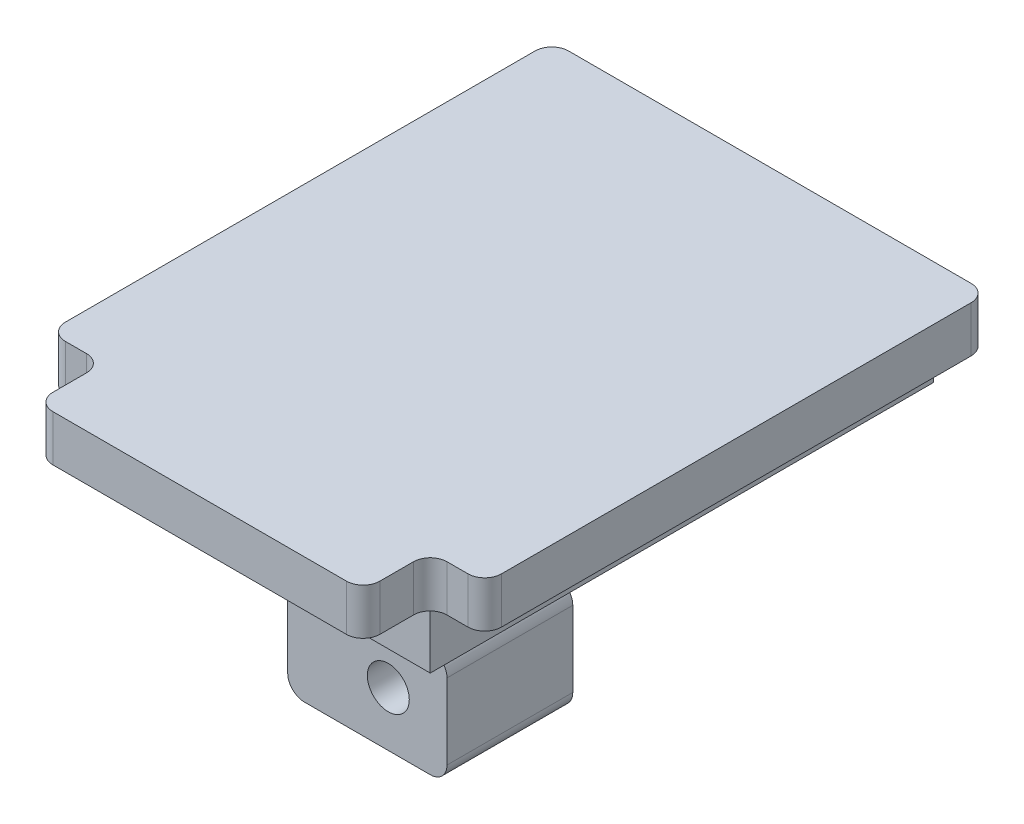
from build123d import *

# Parameters (mm, degrees)
BOSS_EXTRUDE1_DEPTH = 60
SKETCH2_W           = 39
SKETCH2_H           = 5.5
BOSS_EXTRUDE2_DEPTH = 8
FILLET2_R           = 2
SKETCH3_W           = 6
SKETCH3_H           = 15
BOSS_EXTRUDE3_DEPTH = 12
SKETCH4_W           = 19
SKETCH4_H           = 15
BOSS_EXTRUDE4_DEPTH = 13
FILLET3_R           = 2
SKETCH5_R           = 2.5
CUT_EXTRUDE1_DEPTH  = 65.439894475


# Some blends are built 0.0001 mm under size
with BuildPart() as part:
    # Sketch1 → Boss-Extrude1 (new body)
    with BuildSketch(Plane.XY):
        Polygon((-26, 0), (26, 0), (26, -5.5), (19.5, -5.5), (19.5, -12.5), (-19.5, -12.5), (-19.5, -5.5), (-26, -5.5), align=None)
    extrude(amount=BOSS_EXTRUDE1_DEPTH)

    # Sketch2 → Boss-Extrude2 (add)
    with BuildSketch(Plane.XY.offset(60)):
        with Locations((0, -2.75)):
            Rectangle(SKETCH2_W, SKETCH2_H)
    extrude(amount=BOSS_EXTRUDE2_DEPTH)

    # Fillet2
    # the kernel refuses this fillet: 2 mm, written as the material it adds along each edge
    with BuildSketch(Plane(origin=(-19.5, 0, 60), x_dir=(-1, 0, 0), z_dir=(0, -1, 0)), Plane(origin=(19.5, -5.5, 60), x_dir=(1, 0, 0), z_dir=(0, 1, 0))) as fillet2_piece_1:
        with BuildLine():
            CenterArc((FILLET2_R, -FILLET2_R), FILLET2_R, 90, 90)
            Line((0, -FILLET2_R), (0, 0))
            Line((0, 0), (FILLET2_R, 0))
        make_face()
    extrude(amount=5.5)
    # the kernel refuses this fillet: 2 mm, written as the material it takes off along each edge
    with BuildSketch(Plane(origin=(26, 5, 60), x_dir=(-1, 0, 0), z_dir=(0, -1, 0)), Plane(origin=(-19.5, 5, 68), x_dir=(0, 0, -1), z_dir=(0, -1, 0)), Plane(origin=(-26, -10.5, 0), x_dir=(0, 0, 1), z_dir=(0, 1, 0)), Plane(origin=(26, 5, 0), x_dir=(0, 0, 1), z_dir=(0, -1, 0))) as fillet2_2_piece_1:
        with BuildLine():
            CenterArc((FILLET2_R, FILLET2_R), FILLET2_R, 180, 90)
            Line((0, FILLET2_R), (0, 0))
            Line((0, 0), (FILLET2_R, 0))
        make_face()
    extrude(amount=15.5, mode=Mode.SUBTRACT)
    with BuildSketch(Plane(origin=(-26, -10.5, 60), x_dir=(0, 0, -1), z_dir=(0, 1, 0)), Plane(origin=(19.5, -10.5, 68), x_dir=(-1, 0, 0), z_dir=(0, 1, 0))) as fillet2_2_piece_2:
        with BuildLine():
            CenterArc((FILLET2_R, -FILLET2_R), FILLET2_R, 90, 90)
            Line((0, -FILLET2_R), (0, 0))
            Line((0, 0), (FILLET2_R, 0))
        make_face()
    extrude(amount=15.5, mode=Mode.SUBTRACT)

    # Sketch3 → Boss-Extrude3 (add)
    with BuildSketch(Plane.XZ.offset(12.5)):
        with Locations((0, 38)):
            Rectangle(SKETCH3_W, SKETCH3_H)
    extrude(amount=BOSS_EXTRUDE3_DEPTH)

    # Sketch4 → Boss-Extrude4 (add)
    with BuildSketch(Plane.XZ.offset(24.5)):
        with Locations((-2.5, 38)):
            Rectangle(SKETCH4_W, SKETCH4_H)
    extrude(amount=BOSS_EXTRUDE4_DEPTH)

    # Fillet3
    fillet3_edges = [part.edges().sort_by_distance(p)[0] for p in [
        (7, -24.5, 38),
        (-12, -24.5, 38),
        (7, -37.5, 38),
        (-12, -37.5, 38),
        (3, -24.5, 38),
        (-3, -24.5, 38),
    ]]
    fillet(fillet3_edges, radius=FILLET3_R - 0.0001)  # a hair under: the kernel refuses the full size

    # Sketch5 → Cut-Extrude1 (cut, through all)
    with BuildSketch(Plane.XY.offset(45.5)):
        with Locations((0, -31)):
            Circle(SKETCH5_R)
    extrude(amount=-CUT_EXTRUDE1_DEPTH, mode=Mode.SUBTRACT)


solid = part.part
